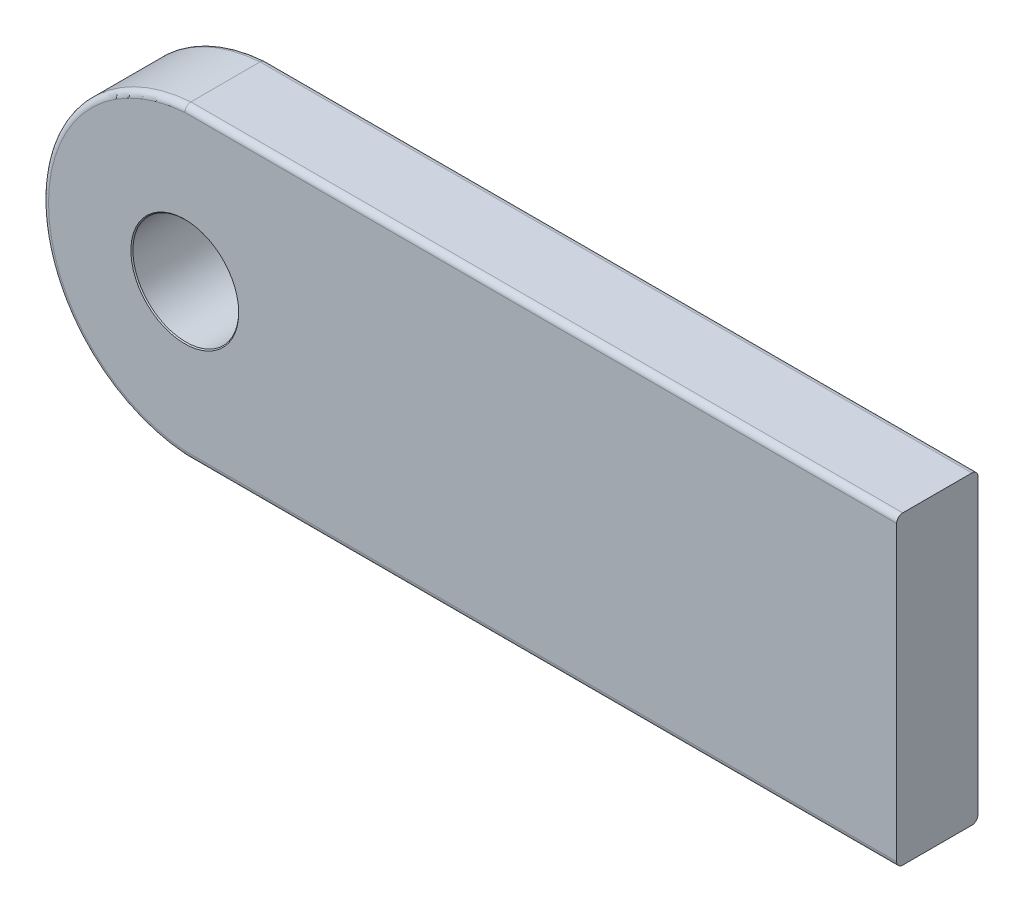
from build123d import *

# Parameters (mm, degrees)
BOSS_EXTRUDE1_DEPTH = 20
SKETCH2_R           = 26
CUT_EXTRUDE1_DEPTH  = 40
SKETCH3_W           = 155.054117715
SKETCH3_H           = 119.807274711
BOSS_EXTRUDE2_DEPTH = 40
FILLET1_R           = 3
CHAMFER1_SIZE       = 0.5


with BuildPart() as part:
    # Sketch1 → Boss-Extrude1 (new, symmetric)
    with BuildSketch(Plane.XY):
        with BuildLine():
            Line((-240.526269825, 75), (109.473730175, 75))
            Line((109.473730175, 75), (109.473730175, 40))
            Line((109.473730175, 40), (-20.526269825, 40))
            Line((-20.526269825, 40), (-20.526269825, -40))
            Line((-20.526269825, -40), (109.473730175, -40))
            Line((109.473730175, -40), (109.473730175, -75))
            Line((109.473730175, -75), (-240.526269825, -75))
            ThreePointArc((-240.526269825, -75), (-310.526269825, 0), (-240.526269825, 75))
        make_face()
    extrude(amount=BOSS_EXTRUDE1_DEPTH, both=True)

    # Sketch2 → Cut-Extrude1 (cut)
    with BuildSketch(Plane.XY.offset(20)):
        with Locations((-240.526269825, 0)):
            Circle(SKETCH2_R)
    extrude(amount=-CUT_EXTRUDE1_DEPTH, mode=Mode.SUBTRACT)

    # Sketch3 → Boss-Extrude2 (add, through all)
    with BuildSketch(Plane.XY.offset(20)):
        with Locations((31.946671317, -2.166338184)):
            Rectangle(SKETCH3_W, SKETCH3_H)
    extrude(amount=-BOSS_EXTRUDE2_DEPTH)

    # Fillet1
    # the kernel refuses this fillet: 3 mm, written as the material it takes off along each edge
    with BuildSketch(Plane(origin=(116.973730175, -75, -20), x_dir=(0, 0, 1), z_dir=(-1, 0, 0)), Plane(origin=(116.973730175, -75, 20), x_dir=(0, 1, 0), z_dir=(-1, 0, 0)), Plane(origin=(-248.026269825, 75, -20), x_dir=(0, 0, 1), z_dir=(1, 0, 0))) as fillet1_piece_1:
        with BuildLine():
            CenterArc((FILLET1_R, FILLET1_R), FILLET1_R, 180, 90)
            Line((0, FILLET1_R), (0, 0))
            Line((0, 0), (FILLET1_R, 0))
        make_face()
    extrude(amount=365, mode=Mode.SUBTRACT)
    with BuildSketch(Plane(origin=(-235.347698397, 0, -20), x_dir=(0.03096596678063506, -0.9995204394615153, 0), z_dir=(0.9995204394615153, 0.03096596678063506, 0))) as fillet1_piece_2:
        with BuildLine():
            CenterArc((75.178571429 - FILLET1_R, -FILLET1_R), FILLET1_R, 0, 90)
            Line((75.178571429, -FILLET1_R), (75.178571429, 0))
            Line((75.178571429, 0), (75.178571429 - FILLET1_R, 0))
        make_face()
    revolve(axis=Axis((-235.347698397, 0, -20), (0, 0, -1)), revolution_arc=183.549005749, mode=Mode.SUBTRACT)
    with BuildSketch(Plane(origin=(-248.026269825, 75, 20), x_dir=(0, 0, -1), z_dir=(1, 0, 0))) as fillet1_piece_3:
        with BuildLine():
            CenterArc((FILLET1_R, -FILLET1_R), FILLET1_R, 90, 90)
            Line((0, -FILLET1_R), (0, 0))
            Line((0, 0), (FILLET1_R, 0))
        make_face()
    extrude(amount=365, mode=Mode.SUBTRACT)
    with BuildSketch(Plane(origin=(-235.347698397, 0, 20), x_dir=(0.03096596678063506, -0.9995204394615153, 0), z_dir=(0.9995204394615153, 0.03096596678063506, 0))) as fillet1_piece_4:
        with BuildLine():
            CenterArc((75.178571429 - FILLET1_R, FILLET1_R), FILLET1_R, 270, 90)
            Line((75.178571429, FILLET1_R), (75.178571429, 0))
            Line((75.178571429, 0), (75.178571429 - FILLET1_R, 0))
        make_face()
    revolve(axis=Axis((-235.347698397, 0, 20), (0, 0, -1)), revolution_arc=183.549005749, mode=Mode.SUBTRACT)

    # Chamfer1
    chamfer1_edges = [part.edges().sort_by_distance(p)[0] for p in [
        (-266.526269825, 0, -20),
        (-266.526269825, 0, 20),
    ]]
    chamfer(chamfer1_edges, length=CHAMFER1_SIZE)


solid = part.part
